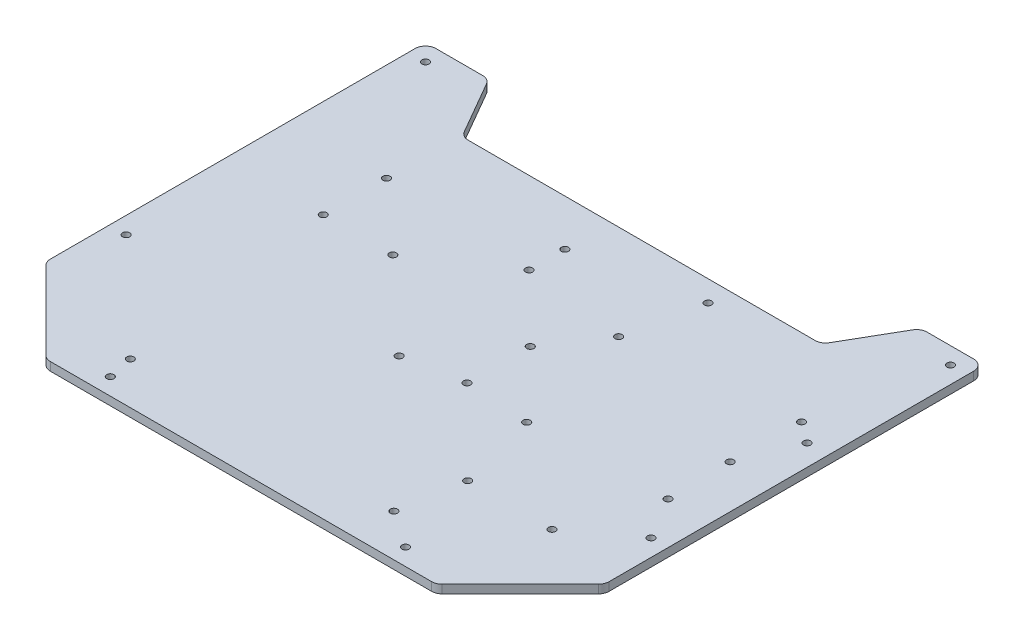
from build123d import *

# Parameters (mm, degrees)
MAIN_EXTRUSION_DEPTH    = 4
CONG_1_R                = 5
ESQUISSE1_R             = 1
ENL_V_MAT_EXTRU_1_DEPTH = 257.850637531
D_GAGEMENT_M31_D        = 3.4
ESQUISSE4_R             = 1
ENL_V_MAT_EXTRU_2_DEPTH = 257.850637531
D_GAGEMENT_M32_D        = 3.4


with BuildPart() as part:
    # Main scetch → Main extrusion (new body)
    with BuildSketch(Plane(origin=(0, 0, 0), x_dir=(1, 0, 0), z_dir=(0, 1, 0))):
        Polygon((-92.5, 0), (92.5, 0), (132.5, 40), (132.5, 220), (102.5, 220), (85.179491924, 190), (-85.179491924, 190), (-102.5, 220), (-132.5, 220), (-132.5, 40), align=None)
    extrude(amount=MAIN_EXTRUSION_DEPTH)

    # Congé1
    cong_1_edges = [part.edges().sort_by_distance(p)[0] for p in [
        (-132.5, 2, -40),
        (-92.5, 2, 0),
        (92.5, 2, 0),
        (132.5, 2, -40),
        (132.5, 2, -220),
        (102.5, 2, -220),
        (85.179491924, 2, -190),
        (-85.179491924, 2, -190),
        (-102.5, 2, -220),
        (-132.5, 2, -220),
    ]]
    fillet(cong_1_edges, radius=CONG_1_R)

    # Esquisse1 → Enlèv. mat.-Extru.1 (cut, through all)
    with BuildSketch(Plane(origin=(0, 4, 0), x_dir=(1, 0, 0), z_dir=(0, 1, 0))):
        with Locations((70, 8)):
            Circle(ESQUISSE1_R)
        with Locations((124.5, 70)):
            Circle(ESQUISSE1_R)
        with Locations((124.5, 212)):
            Circle(ESQUISSE1_R)
        with Locations((-124.5, 212)):
            Circle(ESQUISSE1_R)
        with Locations((-124.5, 70)):
            Circle(ESQUISSE1_R)
        with Locations((-70, 8)):
            Circle(ESQUISSE1_R)
    extrude(amount=-ENL_V_MAT_EXTRU_1_DEPTH, mode=Mode.SUBTRACT)

    # Dégagement M31 (through all)
    with Locations(Plane(origin=(0, 4, 0), x_dir=(1, 0, 0), z_dir=(0, 1, 0))):
        with Locations((-124.5, 212), (-124.5, 70), (-70, 8), (70, 8), (124.5, 70), (124.5, 212)):
            Hole(D_GAGEMENT_M31_D / 2)

    # Esquisse4 → Enlèv. mat.-Extru.2 (cut, through all)
    with BuildSketch(Plane(origin=(0, 4, 0), x_dir=(1, 0, 0), z_dir=(0, 1, 0))):
        with Locations((-86, 125)):
            Circle(ESQUISSE4_R)
        with Locations((-86, 155)):
            Circle(ESQUISSE4_R)
        with Locations((-53, 125)):
            Circle(ESQUISSE4_R)
        with Locations((-14.5, 151.1)):
            Circle(ESQUISSE4_R)
        with Locations((-14.5, 168.1)):
            Circle(ESQUISSE4_R)
        with Locations((41.5, 180)):
            Circle(ESQUISSE4_R)
        with Locations((34.12, 145)):
            Circle(ESQUISSE4_R)
        with Locations((112.5, 153.32)):
            Circle(ESQUISSE4_R)
        with Locations((122.5, 146)):
            Circle(ESQUISSE4_R)
        with Locations((112, 120)):
            Circle(ESQUISSE4_R)
        with Locations((112.5, 90)):
            Circle(ESQUISSE4_R)
        with Locations((17.2, 120)):
            Circle(ESQUISSE4_R)
        with Locations((17.2, 90)):
            Circle(ESQUISSE4_R)
        with Locations((47.5, 88)):
            Circle(ESQUISSE4_R)
        with Locations((57.5, 50)):
            Circle(ESQUISSE4_R)
        with Locations((97.5, 50)):
            Circle(ESQUISSE4_R)
        with Locations((52.5, 20)):
            Circle(ESQUISSE4_R)
        with Locations((-10, 85)):
            Circle(ESQUISSE4_R)
        with Locations((-72.5, 20)):
            Circle(ESQUISSE4_R)
    extrude(amount=-ENL_V_MAT_EXTRU_2_DEPTH, mode=Mode.SUBTRACT)

    # Dégagement M32 (through all)
    with Locations(Plane(origin=(0, 4, 0), x_dir=(1, 0, 0), z_dir=(0, 1, 0))):
        with Locations((-86, 155), (-86, 125), (-53, 125), (17.2, 120), (-14.5, 151.1), (-14.5, 168.1), (34.12, 145), (41.5, 180), (112.5, 153.32), (122.5, 146), (112, 120), (112.5, 90), (47.5, 88), (17.2, 90), (57.5, 50), (97.5, 50), (-10, 85), (-72.5, 20), (52.5, 20)):
            Hole(D_GAGEMENT_M32_D / 2)


solid = part.part
